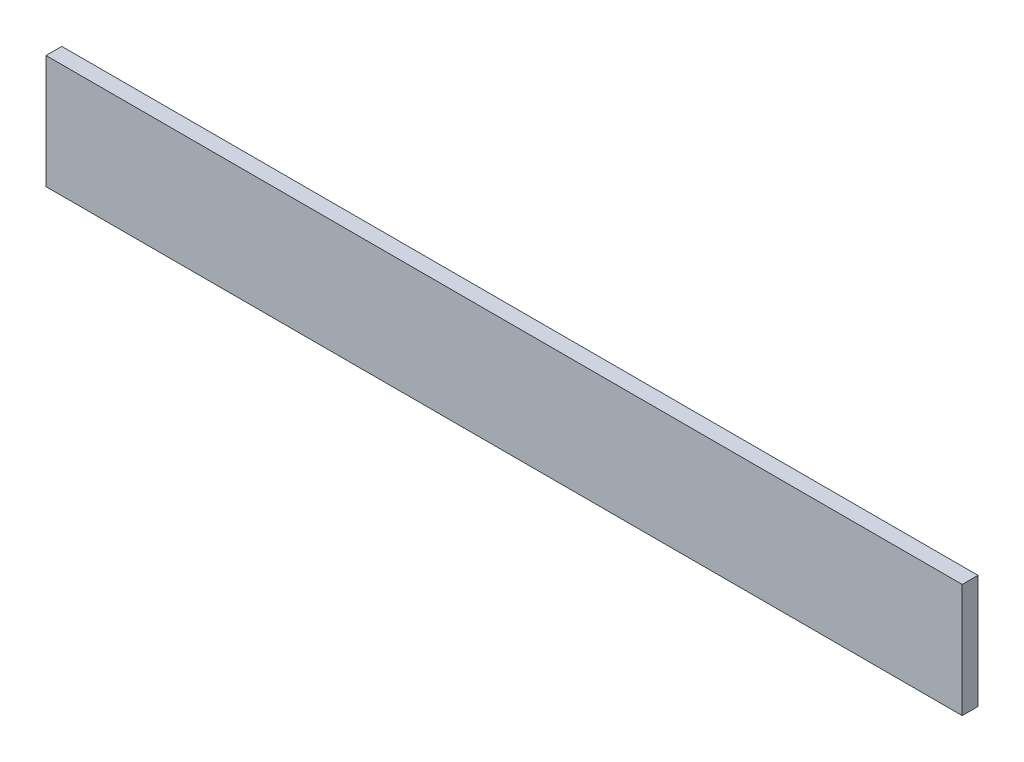
from build123d import *

# Parameters (mm, degrees)
ESQUISSE1_W        = 377
ESQUISSE1_H        = 46.75
BOSS_EXTRU_1_DEPTH = 6.5


with BuildPart() as part:
    # Esquisse1 → Boss.-Extru.1 (new body)
    with BuildSketch(Plane.XY):
        with Locations((45.833177467, 47.178691275)):
            Rectangle(ESQUISSE1_W, ESQUISSE1_H)
    extrude(amount=BOSS_EXTRU_1_DEPTH)


solid = part.part
